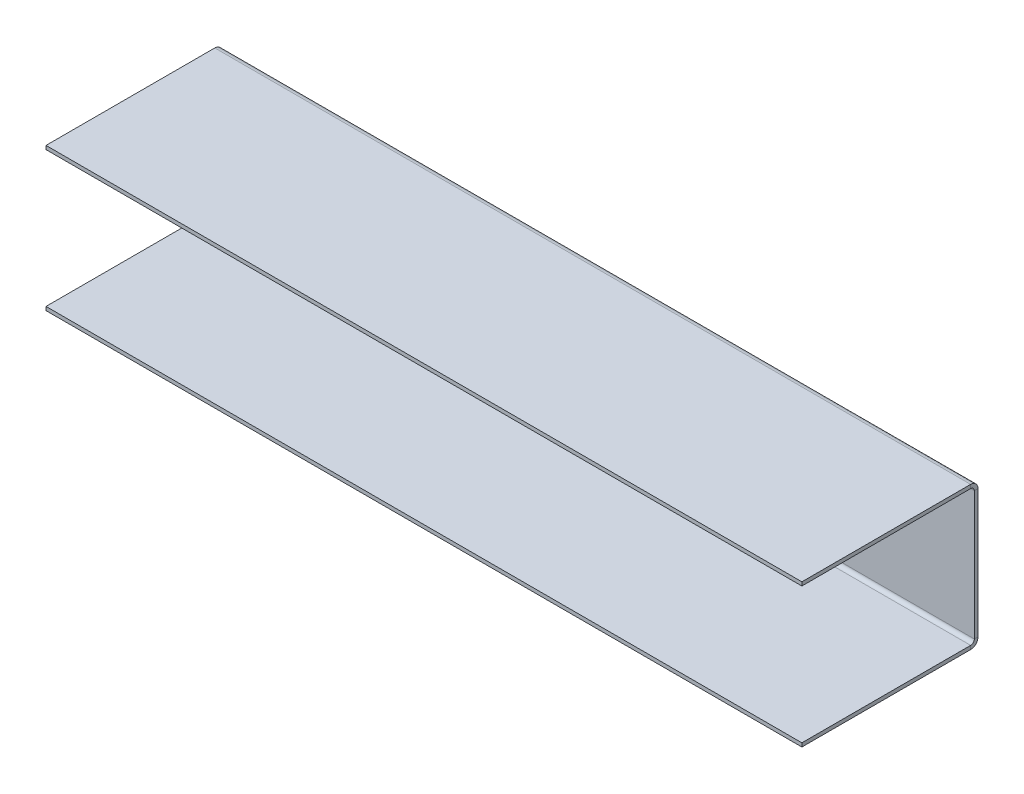
from build123d import *

# Parameters (mm, degrees)
BASE_FLANGE1_DEPTH = 654.05


# Sheet-metal steps are written as plain solids
with BuildPart() as part:
    # Sketch1 → Base-Flange1 (new body)
    with BuildSketch(Plane(origin=(0, 0, 0), x_dir=(0, 0, -1), z_dir=(1, 0, 0))):
        with BuildLine():
            Line((0, 0), (146.05, 0))
            ThreePointArc((146.05, 0), (150.540128061, 1.859871939), (152.4, 6.35))
            Line((152.4, 6.35), (152.4, 117.475))
            ThreePointArc((152.4, 117.475), (150.540128061, 121.965128061), (146.05, 123.825))
            Line((146.05, 123.825), (0, 123.825))
            Line((0, 123.825), (0, 120.65))
            Line((0, 120.65), (146.05, 120.65))
            ThreePointArc((146.05, 120.65), (148.29506403, 119.72006403), (149.225, 117.475))
            Line((149.225, 117.475), (149.225, 6.35))
            ThreePointArc((149.225, 6.35), (148.29506403, 4.10493597), (146.05, 3.175))
            Line((146.05, 3.175), (0, 3.175))
            Line((0, 3.175), (0, 0))
        make_face()
    extrude(amount=BASE_FLANGE1_DEPTH)


solid = part.part
